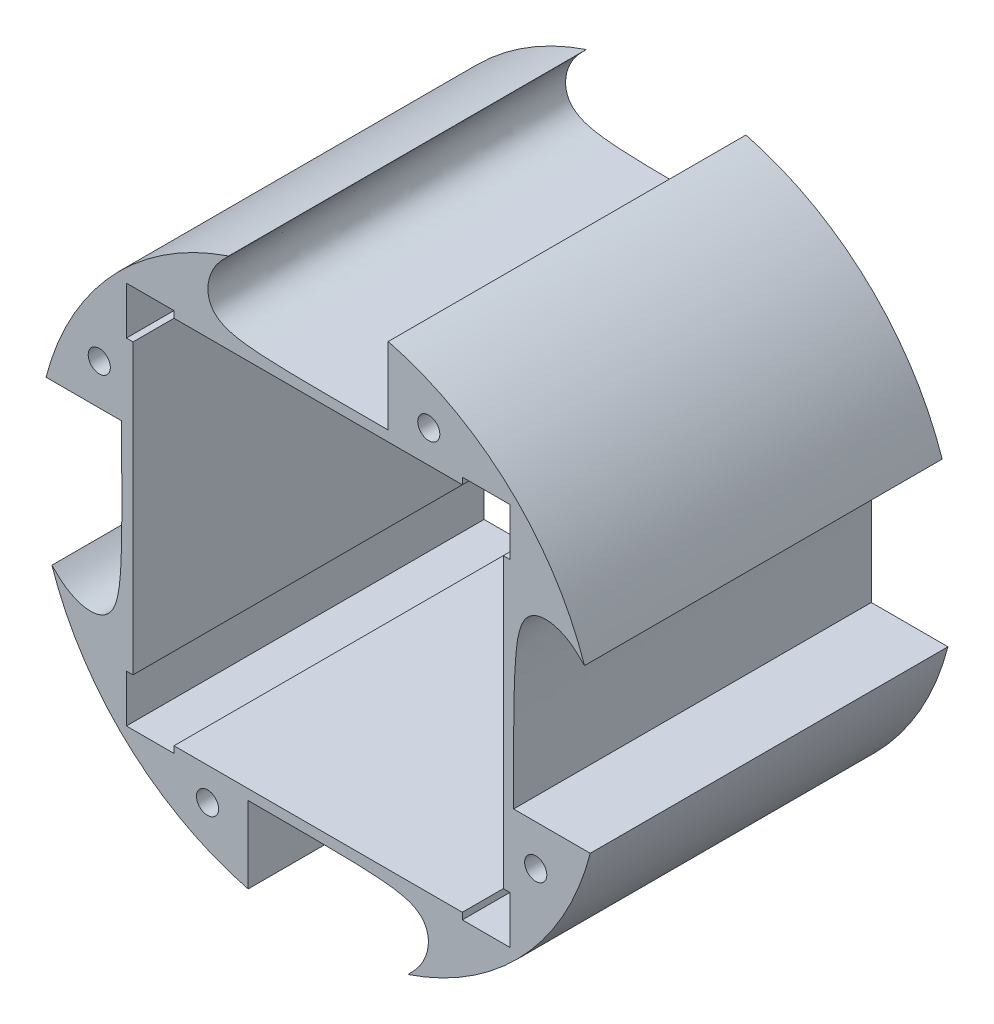
from build123d import *
from build123d.topology import SkipClean

# Parameters (mm, degrees)
BOSS_EXTRUDE3_OUTLINE_R = 3
BOSS_EXTRUDE3_DEPTH     = 97
SKETCH3_R               = 3
BOSS_EXTRUDE4_DEPTH     = 5
BOSS_EXTRUDE5_OUTLINE_R = 3
BOSS_EXTRUDE5_DEPTH     = 6
CUT_EXTRUDE2_DEPTH      = 6
CUT_EXTRUDE6_DEPTH      = 97
CUT_EXTRUDE9_DEPTH      = 97
SKETCH9_W               = 0.4
SKETCH9_H               = 1.8
SKETCH9_W_2             = 1.8
SKETCH9_H_2             = 0.4
BOSS_EXTRUDE6_DEPTH     = 97
SKETCH6_R               = 6.726787931
SKETCH6_R_2             = 3
SKETCH6_R_3             = 6.939010835
SKETCH6_R_4             = 7.483441293
SKETCH6_R_5             = 7.426515464
BOSS_EXTRUDE9_DEPTH     = 6
BOSS_EXTRUDE8_DEPTH     = 97


# Read off the part's stored shape, not the designer's step: Boss-Extrude3, Boss-Extrude5, Cut-Extrude2
with BuildPart() as part:
    # Boss-Extrude3 outline → Boss-Extrude3 (new body)
    with BuildSketch(Plane.XY):
        with BuildLine():
            ThreePointArc((-24.28, 72.228260397), (-55.793380191, 51.899313356), (-73.793224621, 19))
            Line((-73.793224621, 19), (-53.359615493, 19))
            add(Edge.make_bspline(
                [(-72.206415586, -24.344887517), (-69.541086329, -27.040667073), (-67.428574969, -29.089162938), (-64.355831171, -30.241441862), (-60.963009895, -31.073643307), (-59.042545022, -30.561519341), (-56.673971678, -29.217193929), (-54.241382838, -27.488775543), (-53, -25.105954954), (-53, -17.37432721), (-53.359615493, 19)],
                knots=[0, 0, 0, 0, 0, 0, 0, 0, 0, 0, 0, 1, 1, 1, 1, 1, 1, 1, 1, 1, 1, 1], degree=10))
            ThreePointArc((-72.206415586, -24.344887517), (-51.874242853, -55.816690411), (-19, -73.793224621))
            Line((-19, -73.793224621), (-19, -53))
            add(Edge.make_bspline(
                [(24.344887517, -72.206415586), (27.040667073, -69.541086329), (29.089162938, -67.428574969), (30.241441862, -64.355831171), (31.073643307, -60.963009895), (30.561519341, -59.042545022), (29.217193929, -56.673971678), (27.488775543, -54.241382838), (25.105954954, -53), (17.37432721, -53), (-19, -53)],
                knots=[0, 0, 0, 0, 0, 0, 0, 0, 0, 0, 0, 1, 1, 1, 1, 1, 1, 1, 1, 1, 1, 1], degree=10))
            ThreePointArc((24.344887517, -72.206415586), (55.816690411, -51.874242853), (73.793224621, -19))
            Line((73.793224621, -19), (53, -19))
            add(Edge.make_bspline(
                [(72.227927536, 24.280990174), (69.541086329, 27.040667073), (67.428574969, 29.089162938), (64.355831171, 30.241441862), (60.963009895, 31.073643307), (59.042545022, 30.561519341), (56.673971678, 29.217193929), (54.241382838, 27.488775543), (53, 25.105954954), (53, 17.37432721), (53, -19)],
                knots=[0, 0, 0, 0, 0, 0, 0, 0, 0, 0, 0, 1, 1, 1, 1, 1, 1, 1, 1, 1, 1, 1], degree=10))
            ThreePointArc((72.227927536, 24.280990174), (51.89893092, 55.793735933), (19, 73.793224621))
            Line((19, 73.793224621), (19, 53))
            add(Edge.make_bspline(
                [(-24.28, 72.228260397), (-27.040667073, 69.541086329), (-29.089162938, 67.428574969), (-30.241441862, 64.355831171), (-31.073643307, 60.963009895), (-30.561519341, 59.042545022), (-29.217193929, 56.673971678), (-27.488775543, 54.241382838), (-25.105954954, 53), (-17.37432721, 53), (19, 53)],
                knots=[0, 0, 0, 0, 0, 0, 0, 0, 0, 0, 0, 1, 1, 1, 1, 1, 1, 1, 1, 1, 1, 1], degree=10))
        make_face()
        with Locations((-30, -59)):
            Circle(BOSS_EXTRUDE3_OUTLINE_R, mode=Mode.SUBTRACT)
        Polygon((-38.9, -51.6), (-51.6, -51.6), (-51.6, -38.9), (-50, -38.9), (-50, 38.9), (-51.6, 38.9), (-51.6, 51.6), (-38.9, 51.6), (-38.9, 50), (38.9, 50), (38.9, 51.6), (51.6, 51.6), (51.6, 38.9), (50, 38.9), (50, -38.9), (51.6, -38.9), (51.6, -51.6), (38.9, -51.6), (38.9, -50), (-38.9, -50), align=None, mode=Mode.SUBTRACT)
        with Locations((59, -30)):
            Circle(BOSS_EXTRUDE3_OUTLINE_R, mode=Mode.SUBTRACT)
        with Locations((-59.359615493, 30)):
            Circle(BOSS_EXTRUDE3_OUTLINE_R, mode=Mode.SUBTRACT)
        with Locations((30, 59)):
            Circle(BOSS_EXTRUDE3_OUTLINE_R, mode=Mode.SUBTRACT)
    extrude(amount=BOSS_EXTRUDE3_DEPTH)

    # Sketch3 → Boss-Extrude4 (add)
    with BuildSketch(Plane.XY.offset(97)):
        with Locations(Location((-59.359615493, 30, 0), (0, 0, 180))):
            Circle(SKETCH3_R)
    extrude(amount=BOSS_EXTRUDE4_DEPTH)


with BuildPart() as boss_extrude4_kept_piece:
    # of the separate pieces the step leaves, the one the design keeps (boss_extrude4_pieces_kept)
    add(part.part.solids().sort_by_distance((-24.28, 72.228260397, 0))[0])

    # Boss-Extrude5 outline → Boss-Extrude5 (add)
    with BuildSketch(Plane.XY):
        with Locations((-59.359615493, 30)):
            Circle(BOSS_EXTRUDE5_OUTLINE_R)
    extrude(amount=BOSS_EXTRUDE5_DEPTH)

    # Cut-Extrude2 outline → Cut-Extrude2 (cut)
    with BuildSketch(Plane.XY):
        Polygon((-32.75, -54.236860279), (-35.5, -59), (-32.75, -63.763139721), (-27.25, -63.763139721), (-24.5, -59), (-27.25, -54.236860279), align=None)
        Polygon((59, -24.5), (54.236860279, -27.25), (54.236860279, -32.75), (59, -35.5), (63.763139721, -32.75), (63.763139721, -27.25), align=None)
        Polygon((-59.359615493, 35.5), (-64.122755214, 32.75), (-64.122755214, 27.25), (-59.359615493, 24.5), (-54.596475772, 27.25), (-54.596475772, 32.75), align=None)
        Polygon((32.75, 63.763139721), (27.25, 63.763139721), (24.5, 59), (27.25, 54.236860279), (32.75, 54.236860279), (35.5, 59), align=None)
    extrude(amount=CUT_EXTRUDE2_DEPTH, mode=Mode.SUBTRACT)

    # Sketch7 → Cut-Extrude6 (cut)
    with BuildSketch(Plane.XY.offset(97)):
        Polygon((-38.7, -51.8), (-51.8, -51.8), (-51.8, -38.7), (-50.2, -38.7), (-50.2, 38.7), (-51.8, 38.7), (-51.8, 51.8), (-38.7, 51.8), (-38.7, 50.2), (38.7, 50.2), (38.7, 51.8), (51.8, 51.8), (51.8, 38.7), (50.2, 38.7), (50.2, -38.7), (51.8, -38.7), (51.8, -51.8), (38.7, -51.8), (38.7, -50.2), (-38.7, -50.2), align=None)
        Polygon((-38.9, -51.6), (-51.6, -51.6), (-51.6, -38.9), (-50, -38.9), (-50, 38.9), (-51.6, 38.9), (-51.6, 51.6), (-38.9, 51.6), (-38.9, 50), (38.9, 50), (38.9, 51.6), (51.6, 51.6), (51.6, 38.9), (50, 38.9), (50, -38.9), (51.6, -38.9), (51.6, -51.6), (38.9, -51.6), (38.9, -50), (-38.9, -50), align=None, mode=Mode.SUBTRACT)
    extrude(amount=-CUT_EXTRUDE6_DEPTH, mode=Mode.SUBTRACT)

    # Sketch8 → Cut-Extrude9 (cut)
    with BuildSketch(Plane.XY.offset(97)):
        Polygon((-51.8, 38.7), (-51.8, 51.8), (-38.7, 51.8), (-38.7, 52), (-52, 52), (-52, 38.7), align=None)
        Polygon((-51.8, -38.7), (-51.8, -51.8), (-38.7, -51.8), (-38.7, -52), (-52, -52), (-52, -38.7), align=None)
        Polygon((51.8, -38.7), (51.8, -51.8), (38.7, -51.8), (38.7, -52), (52, -52), (52, -38.7), align=None)
        Polygon((51.8, 38.7), (51.8, 51.8), (38.7, 51.8), (38.7, 52), (52, 52), (52, 38.7), align=None)
    extrude(amount=-CUT_EXTRUDE9_DEPTH, mode=Mode.SUBTRACT)

    # Sketch9 → Boss-Extrude6 (add)
    with BuildSketch(Plane.XY.offset(97)):
        with Locations((-38.9, 51.1)):
            Rectangle(SKETCH9_W, SKETCH9_H)
        with Locations((-51.1, 38.9)):
            Rectangle(SKETCH9_W_2, SKETCH9_H_2)
        with Locations((38.9, 51.1)):
            Rectangle(SKETCH9_W, SKETCH9_H)
        with Locations((51.1, 38.9)):
            Rectangle(SKETCH9_W_2, SKETCH9_H_2)
        with Locations((51.1, -38.9)):
            Rectangle(SKETCH9_W_2, SKETCH9_H_2)
        with Locations((38.9, -51.1)):
            Rectangle(SKETCH9_W, SKETCH9_H)
        with Locations((-51.1, -38.9)):
            Rectangle(SKETCH9_W_2, SKETCH9_H_2)
        with Locations((-38.9, -51.1)):
            Rectangle(SKETCH9_W, SKETCH9_H)
    extrude(amount=-BOSS_EXTRUDE6_DEPTH)

    # Sketch6 → Boss-Extrude9 (add)
    # profile 1 of 4: a face of its own
    with SkipClean():  # the faces are left unmerged after this step: merging them gives an invalid solid
        with BuildSketch(Plane(origin=(0, 0, 0), x_dir=(-1, 0, 0), z_dir=(0, 0, -1))):
            with Locations((-30, 59)):
                Circle(SKETCH6_R)
            with Locations((-30, 59)):
                Circle(SKETCH6_R_2, mode=Mode.SUBTRACT)
        # profile 2 of 4: a face of its own
        with BuildSketch(Plane(origin=(0, 0, 0), x_dir=(-1, 0, 0), z_dir=(0, 0, -1))):
            with Locations((59.359615493, 30)):
                Circle(SKETCH6_R_3)
            with Locations((59.359615493, 30)):
                Circle(SKETCH6_R_2, mode=Mode.SUBTRACT)
        # profile 3 of 4: a face of its own
        with BuildSketch(Plane(origin=(0, 0, 0), x_dir=(-1, 0, 0), z_dir=(0, 0, -1))):
            with Locations((30, -59)):
                Circle(SKETCH6_R_4)
            with Locations((30, -59)):
                Circle(SKETCH6_R_2, mode=Mode.SUBTRACT)
        # profile 4 of 4: a face of its own
        with BuildSketch(Plane(origin=(0, 0, 0), x_dir=(-1, 0, 0), z_dir=(0, 0, -1))):
            with Locations((-59, -30)):
                Circle(SKETCH6_R_5)
            with Locations((-59, -30)):
                Circle(SKETCH6_R_2, mode=Mode.SUBTRACT)
        extrude(amount=-BOSS_EXTRUDE9_DEPTH)

    # Sketch11 → Boss-Extrude8 (add)
    with SkipClean():  # the faces are left unmerged after this step: merging them gives an invalid solid
        with BuildSketch(Plane.XY.offset(97)):
            with BuildLine():
                ThreePointArc((-73.793224621, 19), (-76.148989183, -2.787731402), (-72.206415586, -24.344887517))
                add(Edge.make_bspline(
                    [(-53.359615493, 19), (-53, -17.37432721), (-53, -25.105954954), (-54.241382838, -27.488775543), (-56.673971678, -29.217193929), (-59.042545022, -30.561519341), (-60.963009895, -31.073643307), (-64.355831171, -30.241441862), (-67.428574969, -29.089162938), (-69.541086329, -27.040667073), (-72.206415586, -24.344887517)],
                    knots=[0, 0, 0, 0, 0, 0, 0, 0, 0, 0, 0, 1, 1, 1, 1, 1, 1, 1, 1, 1, 1, 1], degree=10))
                Line((-53.359615493, 19), (-73.793224621, 19))
            make_face()
        extrude(amount=BOSS_EXTRUDE8_DEPTH)


with BuildPart() as boss_extrude8_kept_piece:
    # of the separate pieces the step leaves, the one the design keeps (boss_extrude8_pieces_kept)
    add(boss_extrude4_kept_piece.part.solids().sort_by_distance((-24.28, 72.228260397, 0))[0])


solid = boss_extrude8_kept_piece.part
